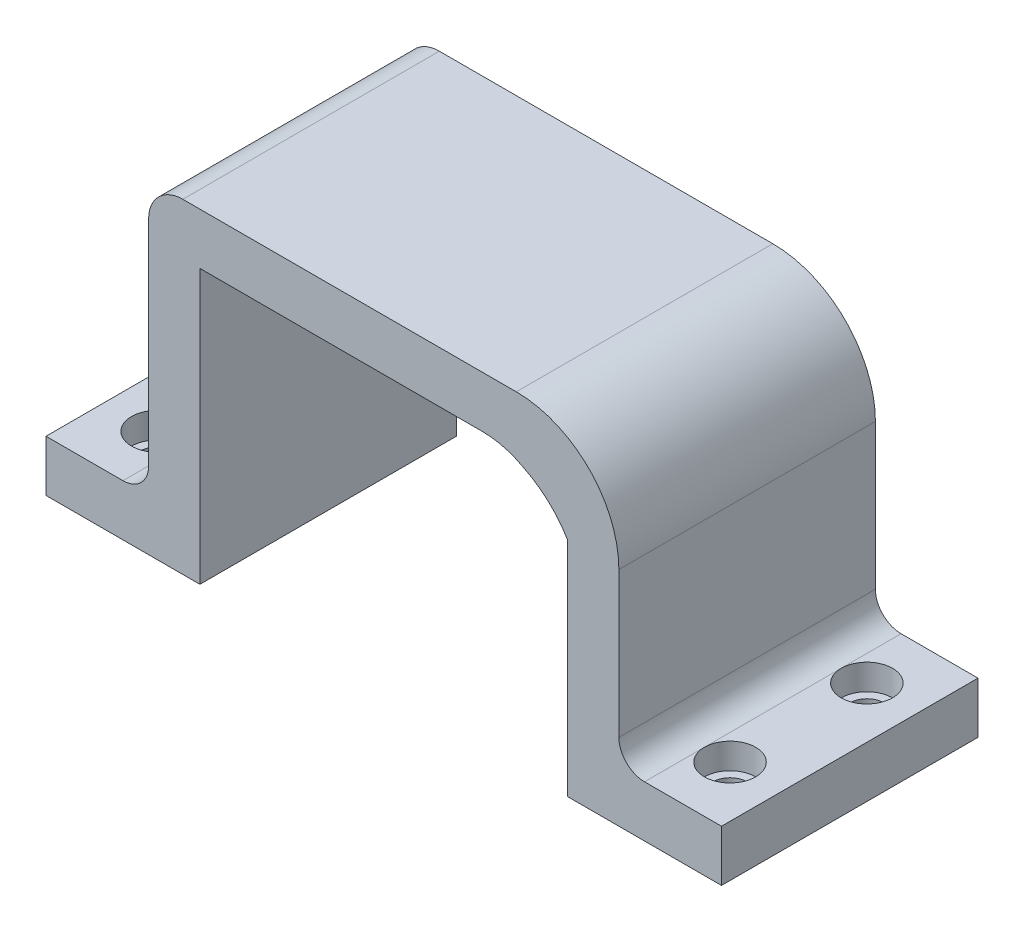
from build123d import *

# Parameters (mm, degrees)
BOSS_EXTRUDE1_DEPTH     = 30
BOSS_EXTRUDE2_START     = -30
BOSS_EXTRUDE2_DEPTH     = 30
CUT_EXTRUDE1_DEPTH      = 93.655275079
CUT_EXTRUDE1_DEPTH_BACK = 93.655275079
SKETCH2_R               = 2
CUT_EXTRUDE3_START      = -1
SKETCH2_3_R             = 3
CUT_EXTRUDE3_DEPTH      = 10
CUT_EXTRUDE2_DEPTH      = 93.655275079
FILLET1_R               = 4
FILLET2_R               = 3


with BuildPart() as part:
    # Sketch1 → Boss-Extrude1 (new body)
    with BuildSketch(Plane.XY):
        with BuildLine():
            Line((0, 0), (18, 0))
            Line((18, 0), (18, 32))
            Line((18, 32), (51, 32))
            ThreePointArc((51, 32), (58.071067812, 29.071067812), (61, 22))
            Line((61, 22), (61, 0))
            Line((61, 0), (79, 0))
            Line((79, 0), (79, 4))
            Line((79, 4), (65, 4))
            Line((65, 4), (65, 26))
            ThreePointArc((65, 26), (62.071067812, 33.071067812), (55, 36))
            Line((55, 36), (14, 36))
            Line((14, 36), (14, 4))
            Line((14, 4), (0, 4))
            Line((0, 4), (0, 0))
        make_face()
    extrude(amount=BOSS_EXTRUDE1_DEPTH)

    # Sketch4 → Boss-Extrude2 (add)
    with BuildSketch(Plane.XY.offset(30).offset(BOSS_EXTRUDE2_START)):
        with BuildLine():
            Line((79, 6), (67, 6))
            Line((67, 6), (67, 26))
            ThreePointArc((67, 26), (63.485281374, 34.485281374), (55, 38))
            Line((55, 38), (12, 38))
            Line((12, 38), (12, 6))
            Line((12, 6), (0, 6))
            Line((0, 6), (0, 4))
            Line((0, 4), (14, 4))
            Line((14, 4), (14, 36))
            Line((14, 36), (55, 36))
            ThreePointArc((55, 36), (62.071067812, 33.071067812), (65, 26))
            Line((65, 26), (65, 4))
            Line((65, 4), (79, 4))
            Line((79, 4), (79, 6))
        make_face()
    extrude(amount=BOSS_EXTRUDE2_DEPTH)

    # Sketch2 (on Top Plane) → Cut-Extrude1 (cut, two sides: drawn at the far end of the back side and taken through both)
    with BuildSketch(Plane(origin=(0, 0, 0), x_dir=(1, 0, 0), z_dir=(0, 1, 0)).offset(-CUT_EXTRUDE1_DEPTH_BACK)):
        with Locations(Location((6, -7, 0), (0, 0, 270))):
            Circle(SKETCH2_R)
        with Locations(Location((6, -23, 0), (0, 0, 270))):
            Circle(SKETCH2_R)
        with Locations(Location((73, -7, 0), (0, 0, 270))):
            Circle(SKETCH2_R)
        with Locations(Location((73, -23, 0), (0, 0, 270))):
            Circle(SKETCH2_R)
    extrude(amount=CUT_EXTRUDE1_DEPTH + CUT_EXTRUDE1_DEPTH_BACK, mode=Mode.SUBTRACT)

    # Sketch2<3> → Cut-Extrude3 (cut)
    with BuildSketch(Plane(origin=(0, 4, 0), x_dir=(1, 0, 0), z_dir=(0, 1, 0)).offset(CUT_EXTRUDE3_START)):
        with Locations(Location((6, -7, 0), (0, 0, 270))):
            Circle(SKETCH2_3_R)
        with Locations(Location((6, -23, 0), (0, 0, 270))):
            Circle(SKETCH2_3_R)
        with Locations(Location((73, -7, 0), (0, 0, 270))):
            Circle(SKETCH2_3_R)
        with Locations(Location((73, -23, 0), (0, 0, 270))):
            Circle(SKETCH2_3_R)
    extrude(amount=CUT_EXTRUDE3_DEPTH, mode=Mode.SUBTRACT)

    # Sketch3 → Cut-Extrude2 (cut, through all)
    with BuildSketch(Plane.XY.offset(30)):
        with BuildLine():
            ThreePointArc((55.768474142, 30.789860884), (59.593158366, 27.114452981), (61, 22))
            Line((61, 22), (61, 26.007623502))
            ThreePointArc((61, 26.007623502), (58.735019606, 28.782480547), (55.768474142, 30.789860884))
        make_face()
    extrude(amount=-CUT_EXTRUDE2_DEPTH, mode=Mode.SUBTRACT)

    # Fillet1
    fillet1_edges = [part.edges().sort_by_distance(p)[0] for p in [
        (12, 38, 15),
    ]]
    fillet(fillet1_edges, radius=FILLET1_R)

    # Fillet2
    fillet2_edges = [part.edges().sort_by_distance(p)[0] for p in [
        (12, 6, 15),
        (67, 6, 15),
    ]]
    fillet(fillet2_edges, radius=FILLET2_R - 0.0001)  # a hair under: the kernel refuses the full size


solid = part.part
